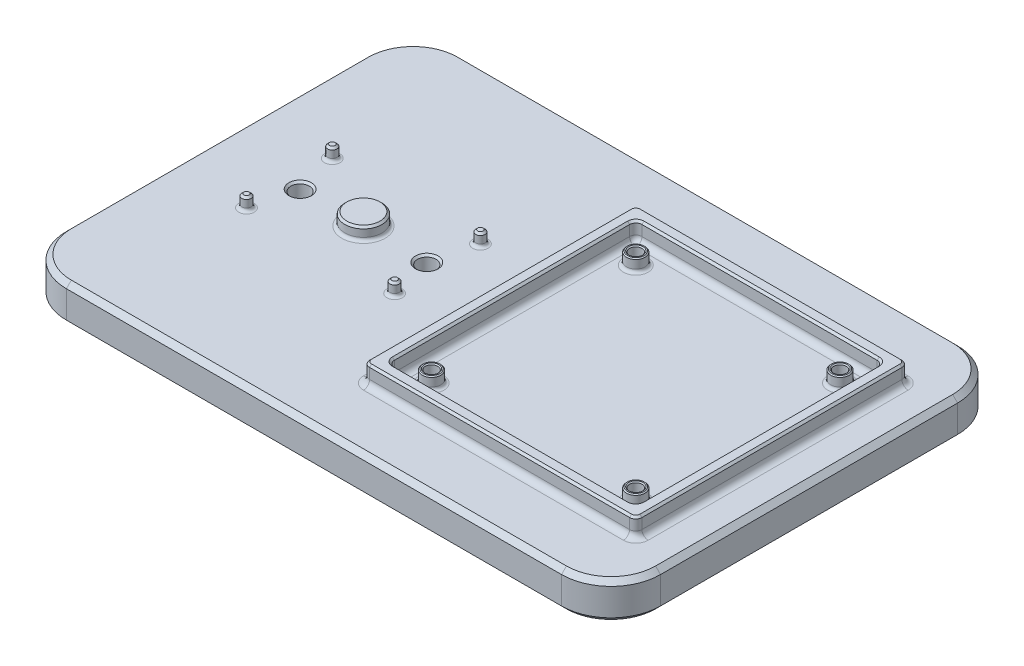
from build123d import *

# Parameters (mm, degrees)
SKETCH2_W           = 152.4
SKETCH2_H           = 101.6
SKETCH2_R           = 1.5875
SKETCH2_R_2         = 2.38125
BOSS_EXTRUDE1_DEPTH = 9.525
SKETCH3_R           = 4.7625
SKETCH3_R_2         = 1.190625
SKETCH3_R_3         = 2.38125
SKETCH3_R_4         = 1.5875
BOSS_EXTRUDE2_DEPTH = 3.175
SKETCH5_W           = 69.85
SKETCH5_H           = 69.85
SKETCH5_W_2         = 63.5
SKETCH5_H_2         = 63.5
BOSS_EXTRUDE4_DEPTH = 4.7625
CUT_EXTRUDE1_DEPTH  = 3.175
CUT_EXTRUDE2_DEPTH  = 2.38125
FILLET2_R           = 12.7
FILLET4_R           = 1.5875
FILLET5_R           = 0.79375
FILLET6_R           = 0.79375
CHAMFER1_SIZE       = 1.27
CHAMFER2_SIZE       = 0.508
CHAMFER3_SIZE       = 0.254


with BuildPart() as part:
    # Sketch2 → Boss-Extrude1 (new body)
    with BuildSketch(Plane(origin=(0, 0, 0), x_dir=(1, 0, 0), z_dir=(0, 1, 0))):
        Rectangle(SKETCH2_W, SKETCH2_H)
        with Locations((57.94375, 26.19375)):
            Circle(SKETCH2_R, mode=Mode.SUBTRACT)
        with Locations((57.94375, -26.19375)):
            Circle(SKETCH2_R, mode=Mode.SUBTRACT)
        with Locations((5.55625, -26.19375)):
            Circle(SKETCH2_R, mode=Mode.SUBTRACT)
        with Locations((5.55625, 26.19375)):
            Circle(SKETCH2_R, mode=Mode.SUBTRACT)
        with Locations((-54.3499929, 0)):
            Circle(SKETCH2_R_2, mode=Mode.SUBTRACT)
        with Locations((-21.8500071, 0)):
            Circle(SKETCH2_R_2, mode=Mode.SUBTRACT)
    extrude(amount=BOSS_EXTRUDE1_DEPTH)

    # Sketch3 → Boss-Extrude2 (add)
    # profile 1 of 9: a face of its own
    with BuildSketch(Plane(origin=(0, 9.525, 0), x_dir=(1, 0, 0), z_dir=(0, 1, 0))):
        with Locations((-38.1, 0)):
            Circle(SKETCH3_R)
    # profile 2 of 9: a face of its own
    with BuildSketch(Plane(origin=(0, 9.525, 0), x_dir=(1, 0, 0), z_dir=(0, 1, 0))):
        with Locations((-57.1000128, 11.0000034)):
            Circle(SKETCH3_R_2)
    # profile 3 of 9: a face of its own
    with BuildSketch(Plane(origin=(0, 9.525, 0), x_dir=(1, 0, 0), z_dir=(0, 1, 0))):
        with Locations((-19.0999872, 11.0000034)):
            Circle(SKETCH3_R_2)
    # profile 4 of 9: a face of its own
    with BuildSketch(Plane(origin=(0, 9.525, 0), x_dir=(1, 0, 0), z_dir=(0, 1, 0))):
        with Locations((-57.1000128, -11.0000034)):
            Circle(SKETCH3_R_2)
    # profile 5 of 9: a face of its own
    with BuildSketch(Plane(origin=(0, 9.525, 0), x_dir=(1, 0, 0), z_dir=(0, 1, 0))):
        with Locations((-19.0999872, -11.0000034)):
            Circle(SKETCH3_R_2)
    # profile 6 of 9: a face of its own
    with BuildSketch(Plane(origin=(0, 9.525, 0), x_dir=(1, 0, 0), z_dir=(0, 1, 0))):
        with Locations((5.55625, 26.19375)):
            Circle(SKETCH3_R_3)
        with Locations((5.55625, 26.19375)):
            Circle(SKETCH3_R_4, mode=Mode.SUBTRACT)
    # profile 7 of 9: a face of its own
    with BuildSketch(Plane(origin=(0, 9.525, 0), x_dir=(1, 0, 0), z_dir=(0, 1, 0))):
        with Locations((57.94375, 26.19375)):
            Circle(SKETCH3_R_3)
        with Locations((57.94375, 26.19375)):
            Circle(SKETCH3_R_4, mode=Mode.SUBTRACT)
    # profile 8 of 9: a face of its own
    with BuildSketch(Plane(origin=(0, 9.525, 0), x_dir=(1, 0, 0), z_dir=(0, 1, 0))):
        with Locations((57.94375, -26.19375)):
            Circle(SKETCH3_R_3)
        with Locations((57.94375, -26.19375)):
            Circle(SKETCH3_R_4, mode=Mode.SUBTRACT)
    # profile 9 of 9: a face of its own
    with BuildSketch(Plane(origin=(0, 9.525, 0), x_dir=(1, 0, 0), z_dir=(0, 1, 0))):
        with Locations((5.55625, -26.19375)):
            Circle(SKETCH3_R_3)
        with Locations((5.55625, -26.19375)):
            Circle(SKETCH3_R_4, mode=Mode.SUBTRACT)
    extrude(amount=BOSS_EXTRUDE2_DEPTH)

    # Sketch5 → Boss-Extrude4 (add)
    with BuildSketch(Plane(origin=(0, 9.525, 0), x_dir=(1, 0, 0), z_dir=(0, 1, 0))):
        with Locations((31.75, 0)):
            Rectangle(SKETCH5_W, SKETCH5_H)
        with Locations((31.75, 0)):
            Rectangle(SKETCH5_W_2, SKETCH5_H_2, mode=Mode.SUBTRACT)
    extrude(amount=BOSS_EXTRUDE4_DEPTH)

    # Sketch6 → Cut-Extrude1 (cut)
    with BuildSketch(Plane.XZ):
        Polygon((-51.600362243, 4.7625), (-57.099623557, 4.7625), (-59.849254214, 0), (-57.099623557, -4.7625), (-51.600362243, -4.7625), (-48.850731586, 0), align=None)
        Polygon((-19.100376443, 4.7625), (-24.599637757, 4.7625), (-27.349268414, 0), (-24.599637757, -4.7625), (-19.100376443, -4.7625), (-16.350745786, 0), align=None)
    extrude(amount=-CUT_EXTRUDE1_DEPTH, mode=Mode.SUBTRACT)

    # Sketch7 → Cut-Extrude2 (cut)
    with BuildSketch(Plane.XZ):
        Polygon((7.425998847, 29.43225), (3.686501153, 29.43225), (1.816752306, 26.19375), (3.686501153, 22.95525), (7.425998847, 22.95525), (9.295747694, 26.19375), align=None)
        Polygon((59.813498847, 29.43225), (56.074001153, 29.43225), (54.204252306, 26.19375), (56.074001153, 22.95525), (59.813498847, 22.95525), (61.683247694, 26.19375), align=None)
        Polygon((7.425998847, -22.95525), (3.686501153, -22.95525), (1.816752306, -26.19375), (3.686501153, -29.43225), (7.425998847, -29.43225), (9.295747694, -26.19375), align=None)
        Polygon((59.813498847, -22.95525), (56.074001153, -22.95525), (54.204252306, -26.19375), (56.074001153, -29.43225), (59.813498847, -29.43225), (61.683247694, -26.19375), align=None)
    extrude(amount=-CUT_EXTRUDE2_DEPTH, mode=Mode.SUBTRACT)

    # Fillet2
    fillet2_edges = [part.edges().sort_by_distance(p)[0] for p in [
        (76.2, 4.7625, 50.8),
        (-76.2, 4.7625, -50.8),
        (76.2, 4.7625, -50.8),
        (-76.2, 4.7625, 50.8),
    ]]
    fillet(fillet2_edges, radius=FILLET2_R)

    # Fillet4
    fillet4_edges = [part.edges().sort_by_distance(p)[0] for p in [
        (0, 11.90625, 31.75),
        (31.75, 9.525, 31.75),
        (0, 9.525, 0),
        (63.5, 9.525, 0),
        (31.75, 9.525, -31.75),
        (63.5, 11.90625, -31.75),
        (63.5, 11.90625, 31.75),
        (0, 11.90625, -31.75),
        (-3.175, 11.90625, -34.925),
        (66.675, 11.90625, -34.925),
        (66.675, 11.90625, 34.925),
        (-3.175, 11.90625, 34.925),
        (66.675, 9.525, 0),
        (31.75, 9.525, -34.925),
        (-3.175, 9.525, 0),
        (31.75, 9.525, 34.925),
    ]]
    fillet(fillet4_edges, radius=FILLET4_R)

    # Fillet5
    fillet5_edges = [part.edges().sort_by_distance(p)[0] for p in [
        (-42.8625, 9.525, 0),
        (3.175, 9.525, -26.19375),
        (55.5625, 9.525, -26.19375),
        (55.5625, 9.525, 26.19375),
        (3.175, 9.525, 26.19375),
    ]]
    fillet(fillet5_edges, radius=FILLET5_R)

    # Fillet6
    fillet6_edges = [part.edges().sort_by_distance(p)[0] for p in [
        (9.295747694, 1.190625, 26.19375),
        (1.816752306, 1.190625, 26.19375),
        (3.686501153, 1.190625, 29.43225),
        (7.425998847, 1.190625, 29.43225),
        (7.425998847, 1.190625, 22.95525),
        (2.75162673, 2.38125, 24.5745),
        (2.75162673, 2.38125, 27.813),
        (5.55625, 2.38125, 29.43225),
        (8.36087327, 2.38125, 27.813),
        (8.36087327, 2.38125, 24.5745),
        (3.686501153, 1.190625, 22.95525),
        (5.55625, 2.38125, 22.95525),
        (-58.2906378, 9.525, -11.0000034),
        (-58.2906378, 9.525, 11.0000034),
        (-20.2906122, 9.525, 11.0000034),
        (-20.2906122, 9.525, -11.0000034),
        (7.425998847, 1.190625, -29.43225),
        (3.686501153, 1.190625, -29.43225),
        (1.816752306, 1.190625, -26.19375),
        (3.686501153, 1.190625, -22.95525),
        (7.425998847, 1.190625, -22.95525),
        (9.295747694, 1.190625, -26.19375),
        (8.36087327, 2.38125, -27.813),
        (5.55625, 2.38125, -29.43225),
        (2.75162673, 2.38125, -27.813),
        (2.75162673, 2.38125, -24.5745),
        (5.55625, 2.38125, -22.95525),
        (8.36087327, 2.38125, -24.5745),
        (59.813498847, 1.190625, -29.43225),
        (56.074001153, 1.190625, -29.43225),
        (54.204252306, 1.190625, -26.19375),
        (56.074001153, 1.190625, -22.95525),
        (59.813498847, 1.190625, -22.95525),
        (61.683247694, 1.190625, -26.19375),
        (60.74837327, 2.38125, -27.813),
        (57.94375, 2.38125, -29.43225),
        (55.13912673, 2.38125, -27.813),
        (55.13912673, 2.38125, -24.5745),
        (57.94375, 2.38125, -22.95525),
        (60.74837327, 2.38125, -24.5745),
        (60.74837327, 2.38125, 24.5745),
        (57.94375, 2.38125, 22.95525),
        (55.13912673, 2.38125, 24.5745),
        (55.13912673, 2.38125, 27.813),
        (57.94375, 2.38125, 29.43225),
        (60.74837327, 2.38125, 27.813),
        (59.813498847, 1.190625, 22.95525),
        (56.074001153, 1.190625, 22.95525),
        (54.204252306, 1.190625, 26.19375),
        (56.074001153, 1.190625, 29.43225),
        (59.813498847, 1.190625, 29.43225),
        (61.683247694, 1.190625, 26.19375),
        (-19.100376443, 1.5875, -4.7625),
        (-24.599637757, 1.5875, -4.7625),
        (-27.349268414, 1.5875, 0),
        (-24.599637757, 1.5875, 4.7625),
        (-19.100376443, 1.5875, 4.7625),
        (-16.350745786, 1.5875, 0),
        (-17.725561114, 3.175, -2.38125),
        (-21.8500071, 3.175, -4.7625),
        (-25.974453086, 3.175, -2.38125),
        (-25.974453086, 3.175, 2.38125),
        (-21.8500071, 3.175, 4.7625),
        (-17.725561114, 3.175, 2.38125),
        (-51.600362243, 1.5875, -4.7625),
        (-57.099623557, 1.5875, -4.7625),
        (-59.849254214, 1.5875, 0),
        (-57.099623557, 1.5875, 4.7625),
        (-51.600362243, 1.5875, 4.7625),
        (-48.850731586, 1.5875, 0),
        (-50.225546914, 3.175, -2.38125),
        (-54.3499929, 3.175, -4.7625),
        (-58.474438886, 3.175, -2.38125),
        (-58.474438886, 3.175, 2.38125),
        (-54.3499929, 3.175, 4.7625),
        (-50.225546914, 3.175, 2.38125),
    ]]
    fillet(fillet6_edges, radius=FILLET6_R)

    # Chamfer1
    chamfer1_edges = [part.edges().sort_by_distance(p)[0] for p in [
        (76.2, 0, 0),
        (72.480256121, 0, -47.080256121),
        (72.480256121, 0, 47.080256121),
        (0, 0, -50.8),
        (0, 0, 50.8),
        (-72.480256121, 0, -47.080256121),
        (-72.480256121, 0, 47.080256121),
        (-76.2, 0, 0),
        (76.2, 9.525, 0),
        (72.480256121, 9.525, -47.080256121),
        (72.480256121, 9.525, 47.080256121),
        (0, 9.525, -50.8),
        (0, 9.525, 50.8),
        (-72.480256121, 9.525, -47.080256121),
        (-72.480256121, 9.525, 47.080256121),
        (-76.2, 9.525, 0),
    ]]
    chamfer(chamfer1_edges, length=CHAMFER1_SIZE)

    # Chamfer2
    chamfer2_edges = [part.edges().sort_by_distance(p)[0] for p in [
        (63.035032015, 14.2875, -31.285032015),
        (31.75, 14.2875, -31.75),
        (0.464967985, 14.2875, -31.285032015),
        (0, 14.2875, 0),
        (0.464967985, 14.2875, 31.285032015),
        (31.75, 14.2875, 31.75),
        (63.035032015, 14.2875, 31.285032015),
        (63.5, 14.2875, 0),
        (66.210032015, 14.2875, -34.460032015),
        (66.675, 14.2875, 0),
        (66.210032015, 14.2875, 34.460032015),
        (31.75, 14.2875, 34.925),
        (-2.710032015, 14.2875, 34.460032015),
        (-3.175, 14.2875, 0),
        (-2.710032015, 14.2875, -34.460032015),
        (31.75, 14.2875, -34.925),
        (-58.2906378, 12.7, -11.0000034),
        (-58.2906378, 12.7, 11.0000034),
        (-20.2906122, 12.7, -11.0000034),
        (-20.2906122, 12.7, 11.0000034),
        (-42.8625, 12.7, 0),
        (-56.7312429, 3.175, 0),
        (-56.7312429, 9.525, 0),
        (-24.2312571, 3.175, 0),
        (-24.2312571, 9.525, 0),
        (-21.8500071, 0, -4.7625),
        (-19.161773219, 0, -4.656157664),
        (-24.538240981, 0, -4.656157664),
        (-17.725561114, 0, -2.38125),
        (-25.974453086, 0, -2.38125),
        (-16.473539338, 0, 0),
        (-27.226474862, 0, 0),
        (-17.725561114, 0, 2.38125),
        (-25.974453086, 0, 2.38125),
        (-19.161773219, 0, 4.656157664),
        (-24.538240981, 0, 4.656157664),
        (-21.8500071, 0, 4.7625),
        (-54.3499929, 0, -4.7625),
        (-51.661759019, 0, -4.656157664),
        (-57.038226781, 0, -4.656157664),
        (-50.225546914, 0, -2.38125),
        (-58.474438886, 0, -2.38125),
        (-48.973525138, 0, 0),
        (-59.726460662, 0, 0),
        (-50.225546914, 0, 2.38125),
        (-58.474438886, 0, 2.38125),
        (-51.661759019, 0, 4.656157664),
        (-57.038226781, 0, 4.656157664),
        (-54.3499929, 0, 4.7625),
    ]]
    chamfer(chamfer2_edges, length=CHAMFER2_SIZE)

    # Chamfer3
    chamfer3_edges = [part.edges().sort_by_distance(p)[0] for p in [
        (3.96875, 2.38125, -26.19375),
        (3.96875, 12.7, -26.19375),
        (3.96875, 2.38125, 26.19375),
        (3.96875, 12.7, 26.19375),
        (56.35625, 2.38125, 26.19375),
        (56.35625, 12.7, 26.19375),
        (56.35625, 2.38125, -26.19375),
        (56.35625, 12.7, -26.19375),
        (3.175, 12.7, -26.19375),
        (3.175, 12.7, 26.19375),
        (55.5625, 12.7, 26.19375),
        (55.5625, 12.7, -26.19375),
        (5.55625, 0, 22.95525),
        (7.364602071, 0, 23.061592336),
        (3.747897929, 0, 23.061592336),
        (8.36087327, 0, 24.5745),
        (2.75162673, 0, 24.5745),
        (9.172954141, 0, 26.19375),
        (1.939545859, 0, 26.19375),
        (8.36087327, 0, 27.813),
        (2.75162673, 0, 27.813),
        (7.364602071, 0, 29.325907664),
        (3.747897929, 0, 29.325907664),
        (5.55625, 0, 29.43225),
        (57.94375, 0, 22.95525),
        (59.752102071, 0, 23.061592336),
        (56.135397929, 0, 23.061592336),
        (60.74837327, 0, 24.5745),
        (55.13912673, 0, 24.5745),
        (61.560454141, 0, 26.19375),
        (54.327045859, 0, 26.19375),
        (60.74837327, 0, 27.813),
        (55.13912673, 0, 27.813),
        (59.752102071, 0, 29.325907664),
        (56.135397929, 0, 29.325907664),
        (57.94375, 0, 29.43225),
        (5.55625, 0, -29.43225),
        (7.364602071, 0, -29.325907664),
        (3.747897929, 0, -29.325907664),
        (8.36087327, 0, -27.813),
        (2.75162673, 0, -27.813),
        (9.172954141, 0, -26.19375),
        (1.939545859, 0, -26.19375),
        (8.36087327, 0, -24.5745),
        (2.75162673, 0, -24.5745),
        (7.364602071, 0, -23.061592336),
        (3.747897929, 0, -23.061592336),
        (5.55625, 0, -22.95525),
        (57.94375, 0, -29.43225),
        (59.752102071, 0, -29.325907664),
        (56.135397929, 0, -29.325907664),
        (60.74837327, 0, -27.813),
        (55.13912673, 0, -27.813),
        (61.560454141, 0, -26.19375),
        (54.327045859, 0, -26.19375),
        (60.74837327, 0, -24.5745),
        (55.13912673, 0, -24.5745),
        (59.752102071, 0, -23.061592336),
        (56.135397929, 0, -23.061592336),
        (57.94375, 0, -22.95525),
    ]]
    chamfer(chamfer3_edges, length=CHAMFER3_SIZE)


solid = part.part
